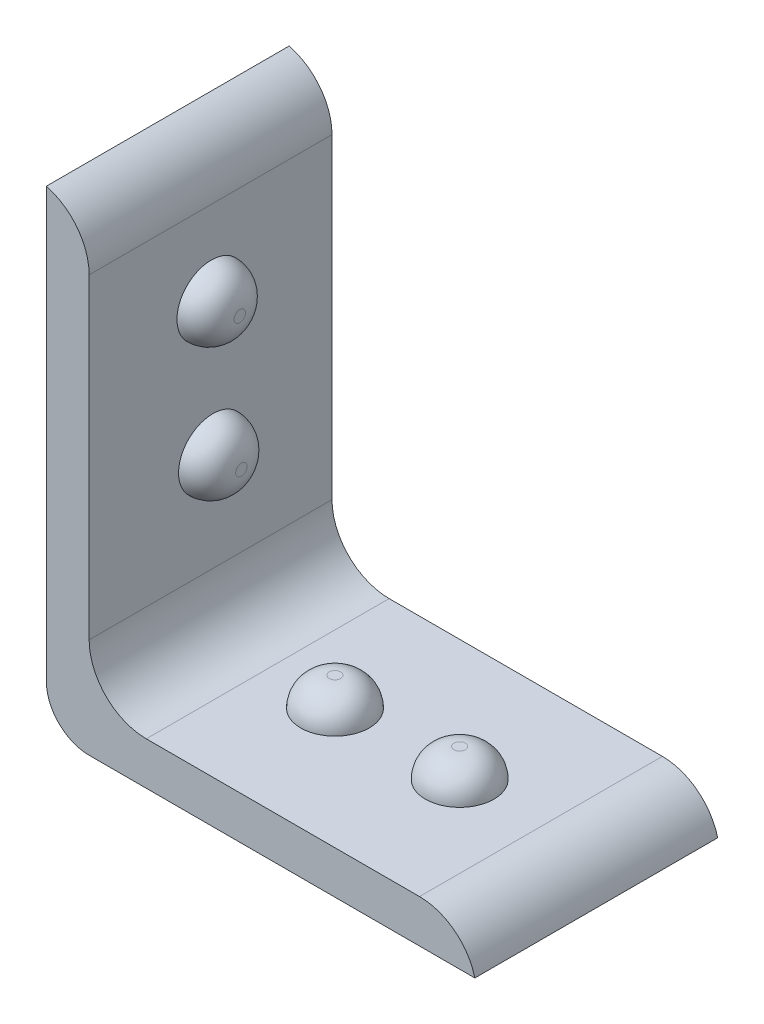
from build123d import *

# Parameters (mm, degrees)
SKETCH1_W           = 38.1
SKETCH1_H           = 21.59
BOSS_EXTRUDE1_DEPTH = 3.81
SKETCH2_W           = 3.81
SKETCH2_H           = 21.59
BOSS_EXTRUDE2_DEPTH = 38.1
FILLET1_R           = 5.08
FILLET2_R           = 3.81
SKETCH4_R           = 3.048
BOSS_EXTRUDE3_DEPTH = 2.54
SKETCH5_R           = 3.048
BOSS_EXTRUDE4_DEPTH = 2.54
FILLET3_R           = 2.54


# Some blends are built 0.0001 mm under size
with BuildPart() as part:
    # Sketch1 → Boss-Extrude1 (new body)
    with BuildSketch(Plane(origin=(0, 0, 0), x_dir=(1, 0, 0), z_dir=(0, 1, 0))):
        with Locations((-28.525509612, -11.453306042)):
            Rectangle(SKETCH1_W, SKETCH1_H)
    extrude(amount=BOSS_EXTRUDE1_DEPTH)

    # Sketch2 → Boss-Extrude2 (add)
    with BuildSketch(Plane(origin=(0, 3.81, 0), x_dir=(1, 0, 0), z_dir=(0, 1, 0))):
        with Locations((-45.670509612, -11.453306042)):
            Rectangle(SKETCH2_W, SKETCH2_H)
    extrude(amount=BOSS_EXTRUDE2_DEPTH)

    # Fillet1
    # the kernel refuses this fillet: 5.08 mm, written as the material it adds along each edge
    with BuildSketch(Plane(origin=(-43.765509612, 3.81, 0.658306042), x_dir=(1, 0, 0), z_dir=(0, 0, 1))) as fillet1_piece_1:
        with BuildLine():
            CenterArc((FILLET1_R, FILLET1_R), FILLET1_R, 180, 90)
            Line((0, FILLET1_R), (0, 0))
            Line((0, 0), (FILLET1_R, 0))
        make_face()
    extrude(amount=21.59)
    # the kernel refuses this fillet: 5.08 mm, written as the material it takes off along each edge
    with BuildSketch(Plane(origin=(-9.475509612, 3.81, -11.638416082), x_dir=(-1, 0, 0), z_dir=(0, 0, 1))) as fillet1_2_piece_1:
        with BuildLine():
            CenterArc((4.91868885, 5.08), FILLET1_R, 194.477512186, 75.522487814)
            Line((0, 3.81), (0, 0))
            Line((0, 0), (4.91868885, 0))
        make_face()
    extrude(amount=46.183444248, mode=Mode.SUBTRACT)
    with BuildSketch(Plane(origin=(-43.765509612, 41.91, -11.638416082), x_dir=(-1, 0, 0), z_dir=(0, 0, 1))) as fillet1_2_piece_2:
        with BuildLine():
            CenterArc((5.08, 4.91868885), FILLET1_R, 180, 75.522487814)
            Line((0, 4.91868885), (0, 0))
            Line((0, 0), (3.81, 0))
        make_face()
    extrude(amount=46.183444248, mode=Mode.SUBTRACT)

    # Fillet2
    fillet2_edges = [part.edges().sort_by_distance(p)[0] for p in [
        (-47.575509612, 0, 11.453306042),
    ]]
    fillet(fillet2_edges, radius=FILLET2_R)

    # Sketch4 → Boss-Extrude3 (add)
    with BuildSketch(Plane(origin=(-43.765509612, 0, 0), x_dir=(0, 0, -1), z_dir=(1, 0, 0))):
        with Locations(Location((-11.392673718, 29.655405516, 0), (0, 0, 180))):
            Circle(SKETCH4_R)
        with Locations(Location((-11.252567749, 17.758913463, 0), (0, 0, 180))):
            Circle(SKETCH4_R)
    extrude(amount=BOSS_EXTRUDE3_DEPTH)

    # Sketch5 → Boss-Extrude4 (add)
    with BuildSketch(Plane(origin=(0, 3.81, 0), x_dir=(1, 0, 0), z_dir=(0, 1, 0))):
        with Locations(Location((-32.655326175, -11.503425175, 0), (0, 0, 90))):
            Circle(SKETCH5_R)
        with Locations(Location((-21.629116904, -11.443282215, 0), (0, 0, 90))):
            Circle(SKETCH5_R)
    extrude(amount=BOSS_EXTRUDE4_DEPTH)

    # Fillet3
    fillet3_edges = [part.edges().sort_by_distance(p)[0] for p in [
        (-41.225509612, 29.655405516, 8.344673718),
        (-41.225509612, 17.758913463, 8.204567749),
        (-32.655326175, 6.35, 14.551425175),
        (-21.629116904, 6.35, 14.491282215),
    ]]
    fillet(fillet3_edges, radius=FILLET3_R - 0.0001)  # a hair under: the kernel refuses the full size


solid = part.part
